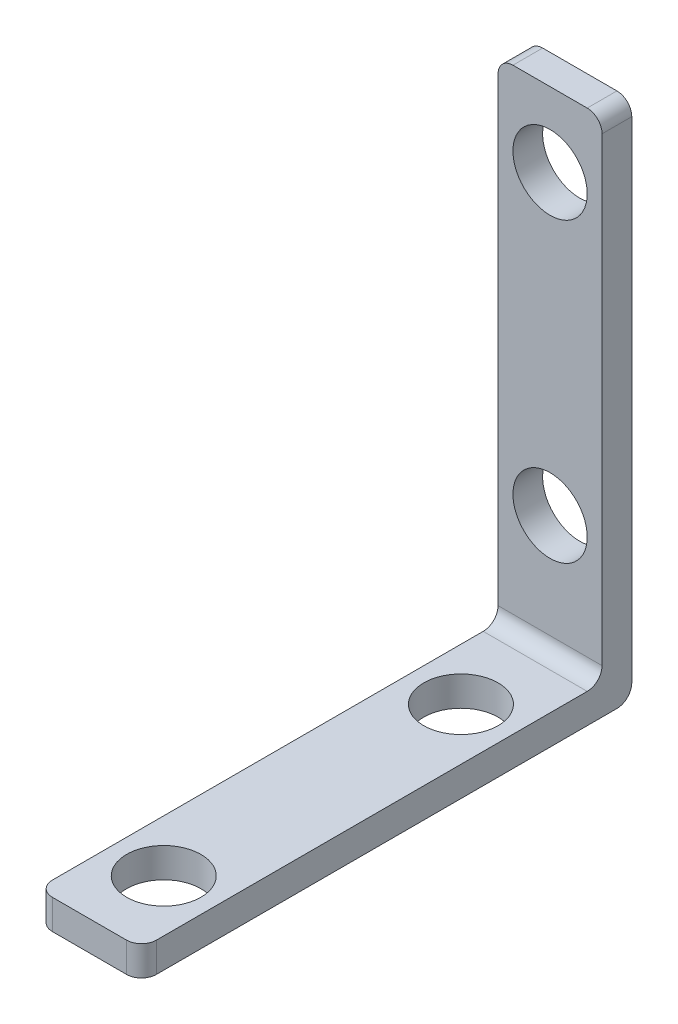
from build123d import *

# Parameters (mm, degrees)
ESQUISSE1_W        = 7
ESQUISSE1_H        = 33
ESQUISSE1_R        = 2.5
BOSS_EXTRU_1_DEPTH = 2
ESQUISSE1_3_W      = 7
ESQUISSE1_3_H      = 2
BOSS_EXTRU_2_DEPTH = 33
CONG_2_DEPTH       = 7
CONG_2_2_OUTLINE_R = 2.5
CONG_2_2_DEPTH     = 2
CONG_2_START       = -1
CONG_2_3_DEPTH     = 4
CONG_2_4_DEPTH     = 9


with BuildPart() as part:
    # Esquisse1 → Boss.-Extru.1 (new body)
    with BuildSketch(Plane.XY):
        with Locations((3.5, 18.5)):
            Rectangle(ESQUISSE1_W, ESQUISSE1_H)
        with Locations((3.5, 10)):
            Circle(ESQUISSE1_R, mode=Mode.SUBTRACT)
        with Locations((3.5, 30)):
            Circle(ESQUISSE1_R, mode=Mode.SUBTRACT)
    extrude(amount=BOSS_EXTRU_1_DEPTH)

    # Esquisse1<3> → Boss.-Extru.2 (add)
    with BuildSketch(Plane.XY):
        with Locations((3.5, 1)):
            Rectangle(ESQUISSE1_3_W, ESQUISSE1_3_H)
    extrude(amount=BOSS_EXTRU_2_DEPTH)

    # Congé2: read off the stored shape, not the designer's step
    # Congé2 outline → Congé2 (add)
    with BuildSketch(Plane.YZ):
        with BuildLine():
            Line((2, 2), (3, 2))
            ThreePointArc((3, 2), (2.292893219, 2.292893219), (2, 3))
            Line((2, 3), (2, 2))
        make_face()
    extrude(amount=CONG_2_DEPTH)

    # Cong_2 2 outline → Cong_2 2 (cut)
    with BuildSketch(Plane(origin=(0, 0, 0), x_dir=(1, 0, 0), z_dir=(0, 1, 0))):
        with Locations((3.5, -8)):
            Circle(CONG_2_2_OUTLINE_R)
        with Locations((3.5, -28)):
            Circle(CONG_2_2_OUTLINE_R)
        with BuildLine():
            Line((7, -33), (7, -32))
            ThreePointArc((7, -32), (6.707106781, -32.707106781), (6, -33))
            Line((6, -33), (7, -33))
        make_face()
        with BuildLine():
            Line((0, -33), (1, -33))
            ThreePointArc((1, -33), (0.292893219, -32.707106781), (0, -32))
            Line((0, -32), (0, -33))
        make_face()
    extrude(amount=CONG_2_2_DEPTH, mode=Mode.SUBTRACT)

    # Cong_2 3 outline → Cong_2 3 (cut)
    with BuildSketch(Plane.XY.offset(CONG_2_START)):
        with BuildLine():
            ThreePointArc((0, 34), (0.292893219, 34.707106781), (1, 35))
            Line((1, 35), (0, 35))
            Line((0, 35), (0, 34))
        make_face()
        with BuildLine():
            ThreePointArc((6, 35), (6.707106781, 34.707106781), (7, 34))
            Line((7, 34), (7, 35))
            Line((7, 35), (6, 35))
        make_face()
    extrude(amount=CONG_2_3_DEPTH, mode=Mode.SUBTRACT)

    # Cong_2 4 outline → Cong_2 4 (cut)
    with BuildSketch(Plane.YZ.offset(CONG_2_START)):
        with BuildLine():
            ThreePointArc((1, 0), (0.292893219, 0.292893219), (0, 1))
            Line((0, 1), (0, 0))
            Line((0, 0), (1, 0))
        make_face()
    extrude(amount=CONG_2_4_DEPTH, mode=Mode.SUBTRACT)


solid = part.part
